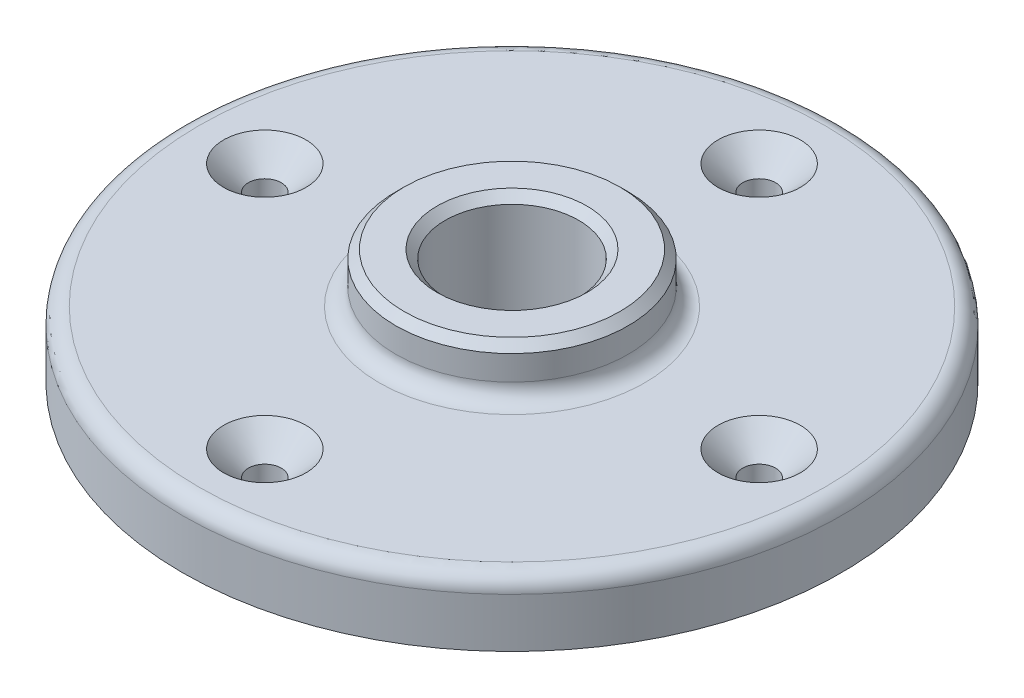
from build123d import *

# Parameters (mm, degrees)
SKETCH1_R                    = 20
BOSS_EXTRUDE1_DEPTH          = 4
SKETCH2_R                    = 4.05
CUT_EXTRUDE1_DEPTH           = 29.565713714
SKETCH3_R                    = 1
CUT_EXTRUDE2_DEPTH           = 29.565713714
CHAMFER1_SIZE                = 1.5
CIRPATTERN1_COUNT            = 4
CHAMFER1_OF_CIRPATTERN1_SIZE = 1.5
FILLET1_R                    = 1
BOSS_EXTRUDE2_START          = 3
SKETCH4_R                    = 7.05
SKETCH4_R_2                  = 4.05
BOSS_EXTRUDE2_DEPTH          = 3
CHAMFER2_SIZE                = 0.5
FILLET2_R                    = 1
CHAMFER3_SIZE                = 0.5


with BuildPart() as part:
    # Sketch1 → Boss-Extrude1 (new body)
    with BuildSketch(Plane(origin=(0, 0, 0), x_dir=(1, 0, 0), z_dir=(0, 1, 0))):
        Circle(SKETCH1_R)
    extrude(amount=BOSS_EXTRUDE1_DEPTH)

    # Sketch2 → Cut-Extrude1 (cut, through all)
    with BuildSketch(Plane(origin=(0, 4, 0), x_dir=(1, 0, 0), z_dir=(0, 1, 0))):
        Circle(SKETCH2_R)
    extrude(amount=-CUT_EXTRUDE1_DEPTH, mode=Mode.SUBTRACT)

    # Sketch3 → Cut-Extrude2 (cut, through all)
    with BuildSketch(Plane(origin=(0, 4, 0), x_dir=(1, 0, 0), z_dir=(0, 1, 0))):
        with Locations((0, 15)):
            Circle(SKETCH3_R)
    cut_extrude2 = extrude(amount=-CUT_EXTRUDE2_DEPTH, mode=Mode.SUBTRACT)

    # Chamfer1
    chamfer1_edges = [part.edges().sort_by_distance(p)[0] for p in [
        (-1, 4, -15),
    ]]
    chamfer(chamfer1_edges, length=CHAMFER1_SIZE)

    # CirPattern1: Cut-Extrude2 ×4 about axis
    cirpattern1_axis = Axis((0, 0, 0), (0, 1, 0))
    for i in range(1, CIRPATTERN1_COUNT):
        add(cut_extrude2.rotate(cirpattern1_axis, i * 360 / CIRPATTERN1_COUNT), mode=Mode.SUBTRACT)

    # Chamfer1 of CirPattern1
    chamfer1_of_cirpattern1_edges = [part.edges().sort_by_distance(p)[0] for p in [
        (-15, 4, 1),
        (1, 4, 15),
        (15, 4, -1),
    ]]
    chamfer(chamfer1_of_cirpattern1_edges, length=CHAMFER1_OF_CIRPATTERN1_SIZE)

    # Fillet1
    fillet1_edges = [part.edges().sort_by_distance(p)[0] for p in [
        (-20, 4, 0),
    ]]
    fillet(fillet1_edges, radius=FILLET1_R)

    # Sketch4 → Boss-Extrude2 (add)
    with BuildSketch(Plane(origin=(0, 4, 0), x_dir=(1, 0, 0), z_dir=(0, 1, 0)).offset(BOSS_EXTRUDE2_START)):
        Circle(SKETCH4_R)
        Circle(SKETCH4_R_2, mode=Mode.SUBTRACT)
    extrude(amount=-BOSS_EXTRUDE2_DEPTH)

    # Chamfer2
    chamfer2_edges = [part.edges().sort_by_distance(p)[0] for p in [
        (-4.05, 7, 0),
    ]]
    chamfer(chamfer2_edges, length=CHAMFER2_SIZE)

    # Fillet2
    fillet2_edges = [part.edges().sort_by_distance(p)[0] for p in [
        (-7.05, 4, 0),
    ]]
    fillet(fillet2_edges, radius=FILLET2_R)

    # Chamfer3
    chamfer3_edges = [part.edges().sort_by_distance(p)[0] for p in [
        (-7.05, 7, 0),
    ]]
    chamfer(chamfer3_edges, length=CHAMFER3_SIZE)


solid = part.part
